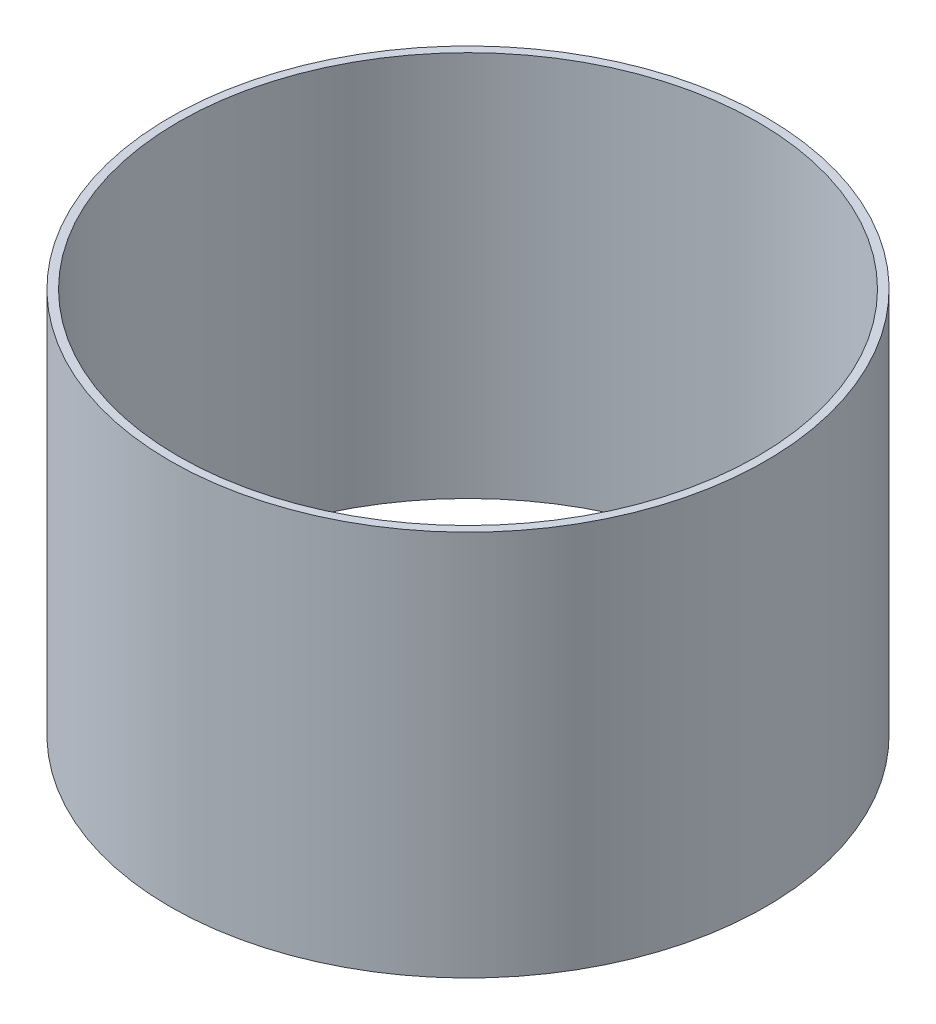
from build123d import *

# Parameters (mm, degrees)
BODY_TUBE_PROFILE_R        = 78.359
BODY_TUBE_PROFILE_R_2      = 76.2
BODY_TUBE_EXTRUSTION_DEPTH = 101.6


with BuildPart() as part:
    # Body Tube Profile → Body Tube Extrustion (new body)
    with BuildSketch(Plane(origin=(0, 0, 0), x_dir=(1, 0, 0), z_dir=(0, 1, 0))):
        Circle(BODY_TUBE_PROFILE_R)
        Circle(BODY_TUBE_PROFILE_R_2, mode=Mode.SUBTRACT)
    extrude(amount=BODY_TUBE_EXTRUSTION_DEPTH)


solid = part.part
